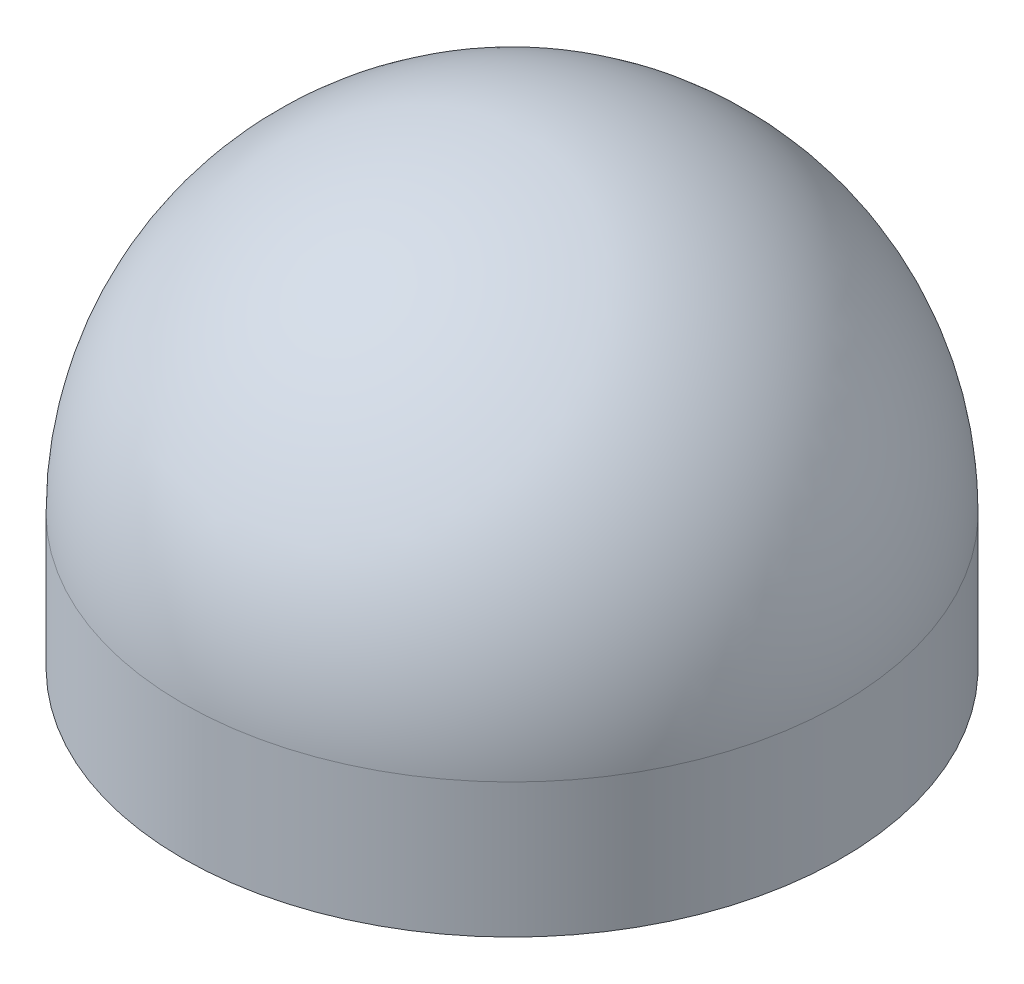
from build123d import *

# Parameters (mm, degrees)
REVOLVE_1_ANGLE = 180
SKETCH_6_W      = 2.099465061
SKETCH_6_H      = 0.856193899
SKETCH_7_W      = 2.050484964
SKETCH_7_H      = 0.752512397


with BuildPart() as part:
    # 草图1 → 旋转1 (revolve)
    with BuildSketch(Plane(origin=(0, 0, 0), x_dir=(1, 0, 0), z_dir=(0, 1, 0))):
        with BuildLine():
            Line((0, 2.1), (0, -2.1))
            ThreePointArc((0, -2.1), (2.1, 0), (0, 2.1))
        make_face()
    revolve(axis=Axis((0, 0, -2.1), (0, 0, 1)), revolution_arc=REVOLVE_1_ANGLE)

    # 草图6 → 旋转2 (revolve)
    with BuildSketch(Plane(origin=(0, 0, 0), x_dir=(0, 0, -1), z_dir=(1, 0, 0))):
        with Locations((1.049732531, -0.42809695)):
            Rectangle(SKETCH_6_W, SKETCH_6_H)
    revolve(axis=Axis((0, 0, 0), (0, -1, 0)))

    # 草图7 → 切除-旋转2 (revolve, cut)
    with BuildSketch(Plane(origin=(0, 0, 0), x_dir=(0, 0, -1), z_dir=(1, 0, 0))):
        with Locations((1.025242482, -0.479937701)):
            Rectangle(SKETCH_7_W, SKETCH_7_H)
    revolve(axis=Axis((0, -0.103681502, 0), (0, -1, 0)), mode=Mode.SUBTRACT)


solid = part.part
